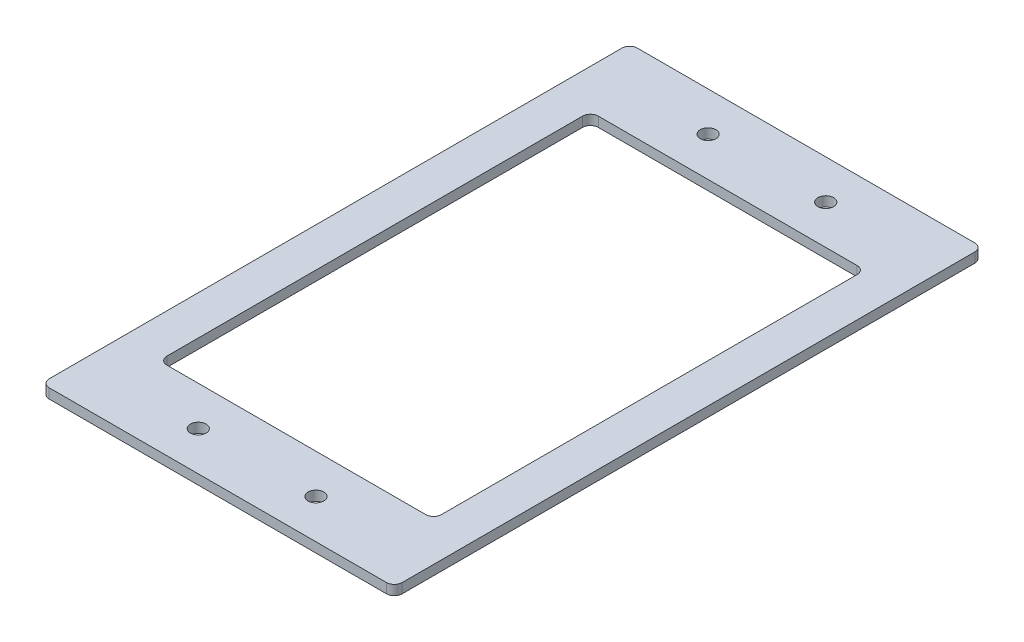
from build123d import *

# Parameters (mm, degrees)
SKETCH1_W           = 114.3
SKETCH1_H           = 190.5
SKETCH1_W_2         = 88.9
SKETCH1_H_2         = 139.7
BOSS_EXTRUDE1_DEPTH = 3.175
SKETCH2_R           = 2.54
CUT_EXTRUDE1_DEPTH  = 4.7625
FILLET1_R           = 2.54
FILLET2_R           = 2.54


with BuildPart() as part:
    # Sketch1 → Boss-Extrude1 (new body)
    with BuildSketch(Plane(origin=(0, 0, 0), x_dir=(1, 0, 0), z_dir=(0, 1, 0))):
        Rectangle(SKETCH1_W, SKETCH1_H)
        Rectangle(SKETCH1_W_2, SKETCH1_H_2, mode=Mode.SUBTRACT)
    extrude(amount=BOSS_EXTRUDE1_DEPTH)

    # Sketch2 → Cut-Extrude1 (cut)
    with BuildSketch(Plane(origin=(0, 3.175, 0), x_dir=(1, 0, 0), z_dir=(0, 1, 0))):
        with Locations((19.05, -82.55)):
            Circle(SKETCH2_R)
        with Locations((19.05, 82.55)):
            Circle(SKETCH2_R)
        with Locations((-19.05, -82.55)):
            Circle(SKETCH2_R)
        with Locations((-19.05, 82.55)):
            Circle(SKETCH2_R)
    extrude(amount=-CUT_EXTRUDE1_DEPTH, mode=Mode.SUBTRACT)

    # Fillet1
    fillet1_edges = [part.edges().sort_by_distance(p)[0] for p in [
        (44.45, 1.5875, -69.85),
        (-44.45, 1.5875, -69.85),
        (-44.45, 1.5875, 69.85),
        (44.45, 1.5875, 69.85),
    ]]
    fillet(fillet1_edges, radius=FILLET1_R)

    # Fillet2
    fillet2_edges = [part.edges().sort_by_distance(p)[0] for p in [
        (-57.15, 1.5875, 95.25),
        (-57.15, 1.5875, -95.25),
        (57.15, 1.5875, -95.25),
        (57.15, 1.5875, 95.25),
    ]]
    fillet(fillet2_edges, radius=FILLET2_R)


solid = part.part
